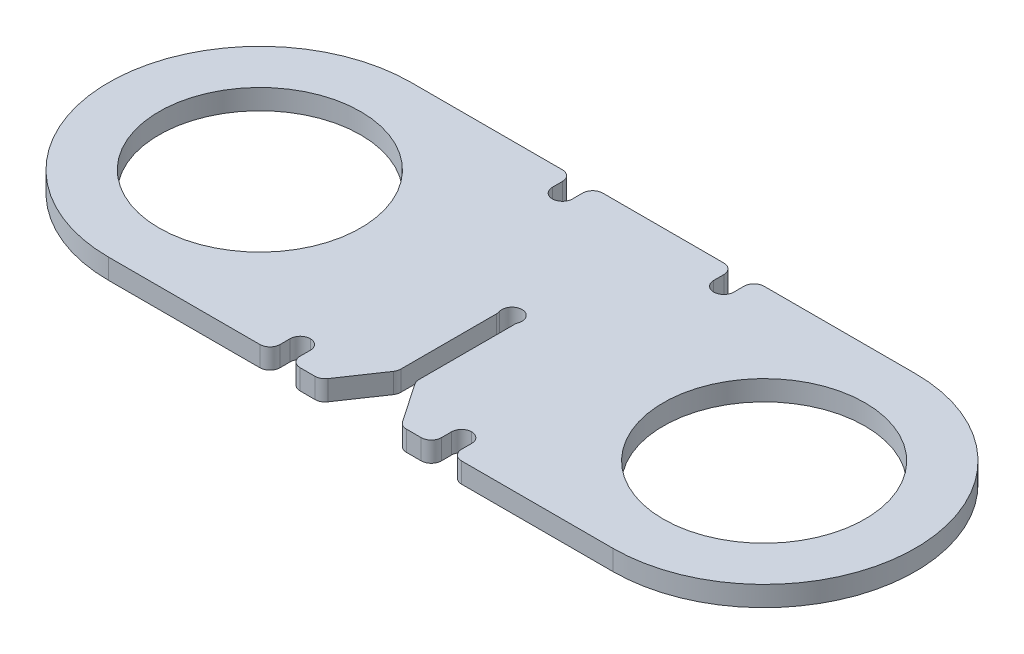
from build123d import *

# Parameters (mm, degrees)
SKETCH1_R           = 10
SKETCH1_R_2         = 1
BOSS_EXTRUDE1_DEPTH = 2
SKETCH2_W           = 2
SKETCH2_H           = 3
CUT_EXTRUDE1_DEPTH  = 72.617037079
FILLET1_START       = -1
FILLET1_DEPTH       = 4
FILLET1_2_DEPTH     = 2
CUT_EXTRUDE2_DEPTH  = 72.617037079
FILLET2_R           = 1


with BuildPart() as part:
    # Sketch1 → Boss-Extrude1 (new body)
    with BuildSketch(Plane(origin=(0, 0, 0), x_dir=(1, 0, 0), z_dir=(0, 1, 0))):
        with BuildLine():
            Line((0, 0), (50, 0))
            ThreePointArc((50, 0), (65, 15), (50, 30))
            Line((50, 30), (0, 30))
            ThreePointArc((0, 30), (-15, 15), (0, 0))
        make_face()
        with Locations(Location((0, 15, 0), (0, 0, 270))):
            Circle(SKETCH1_R, mode=Mode.SUBTRACT)
        with Locations(Location((50, 15, 0), (0, 0, 270))):
            Circle(SKETCH1_R, mode=Mode.SUBTRACT)
        with Locations(Location((25, 15, 0), (0, 0, 270))):
            Circle(SKETCH1_R_2, mode=Mode.SUBTRACT)
    extrude(amount=BOSS_EXTRUDE1_DEPTH)

    # Sketch2 → Cut-Extrude1 (cut, through all)
    with BuildSketch(Plane(origin=(0, 2, 0), x_dir=(1, 0, 0), z_dir=(0, 1, 0))):
        with Locations((17, 28.5)):
            Rectangle(SKETCH2_W, SKETCH2_H)
        with Locations((33, 28.5)):
            Rectangle(SKETCH2_W, SKETCH2_H)
        with Locations((17, 1.5)):
            Rectangle(SKETCH2_W, SKETCH2_H)
        with Locations((33, 1.5)):
            Rectangle(SKETCH2_W, SKETCH2_H)
    extrude(amount=-CUT_EXTRUDE1_DEPTH, mode=Mode.SUBTRACT)

    # Fillet1: read off the stored shape, not the designer's step
    # Fillet1 outline → Fillet1 (cut)
    with BuildSketch(Plane(origin=(0, 0, 0), x_dir=(1, 0, 0), z_dir=(0, 1, 0)).offset(FILLET1_START)):
        with BuildLine():
            ThreePointArc((35, 0), (34.292893219, 0.292893219), (34, 1))
            Line((34, 1), (34, 0))
            Line((34, 0), (35, 0))
        make_face()
        with BuildLine():
            ThreePointArc((32, 1), (31.707106781, 0.292893219), (31, 0))
            Line((31, 0), (32, 0))
            Line((32, 0), (32, 1))
        make_face()
        with BuildLine():
            ThreePointArc((19, 0), (18.292893219, 0.292893219), (18, 1))
            Line((18, 1), (18, 0))
            Line((18, 0), (19, 0))
        make_face()
        with BuildLine():
            ThreePointArc((16, 1), (15.707106781, 0.292893219), (15, 0))
            Line((15, 0), (16, 0))
            Line((16, 0), (16, 1))
        make_face()
        with BuildLine():
            ThreePointArc((15, 30), (15.707106781, 29.707106781), (16, 29))
            Line((16, 29), (16, 30))
            Line((16, 30), (15, 30))
        make_face()
        with BuildLine():
            ThreePointArc((18, 29), (18.292893219, 29.707106781), (19, 30))
            Line((19, 30), (18, 30))
            Line((18, 30), (18, 29))
        make_face()
        with BuildLine():
            ThreePointArc((31, 30), (31.707106781, 29.707106781), (32, 29))
            Line((32, 29), (32, 30))
            Line((32, 30), (31, 30))
        make_face()
        with BuildLine():
            ThreePointArc((34, 29), (34.292893219, 29.707106781), (35, 30))
            Line((35, 30), (34, 30))
            Line((34, 30), (34, 29))
        make_face()
    extrude(amount=FILLET1_DEPTH, mode=Mode.SUBTRACT)

    # Fillet1 2 outline → Fillet1 2 (add)
    with BuildSketch(Plane(origin=(0, 0, 0), x_dir=(1, 0, 0), z_dir=(0, 1, 0))):
        with BuildLine():
            Line((34, 3), (33, 3))
            ThreePointArc((33, 3), (33.707106781, 2.707106781), (34, 2))
            Line((34, 2), (34, 3))
        make_face()
        with BuildLine():
            Line((32, 3), (32, 2))
            ThreePointArc((32, 2), (32.292893219, 2.707106781), (33, 3))
            Line((33, 3), (32, 3))
        make_face()
        with BuildLine():
            Line((18, 3), (17, 3))
            ThreePointArc((17, 3), (17.707106781, 2.707106781), (18, 2))
            Line((18, 2), (18, 3))
        make_face()
        with BuildLine():
            Line((16, 3), (16, 2))
            ThreePointArc((16, 2), (16.292893219, 2.707106781), (17, 3))
            Line((17, 3), (16, 3))
        make_face()
        with BuildLine():
            Line((16, 27), (17, 27))
            ThreePointArc((17, 27), (16.292893219, 27.292893219), (16, 28))
            Line((16, 28), (16, 27))
        make_face()
        with BuildLine():
            Line((18, 27), (18, 28))
            ThreePointArc((18, 28), (17.707106781, 27.292893219), (17, 27))
            Line((17, 27), (18, 27))
        make_face()
        with BuildLine():
            Line((32, 27), (33, 27))
            ThreePointArc((33, 27), (32.292893219, 27.292893219), (32, 28))
            Line((32, 28), (32, 27))
        make_face()
        with BuildLine():
            Line((34, 27), (34, 28))
            ThreePointArc((34, 28), (33.707106781, 27.292893219), (33, 27))
            Line((33, 27), (34, 27))
        make_face()
    extrude(amount=FILLET1_2_DEPTH)

    # Sketch3 → Cut-Extrude2 (cut, through all)
    with BuildSketch(Plane(origin=(0, 2, 0), x_dir=(1, 0, 0), z_dir=(0, 1, 0))):
        Polygon((24.1, 14.564110106), (25.9, 14.564110106), (25.9, 4.564110106), (29, 0), (21, 0), (24.1, 4.564110106), align=None)
    extrude(amount=-CUT_EXTRUDE2_DEPTH, mode=Mode.SUBTRACT)

    # Fillet2
    fillet2_edges = [part.edges().sort_by_distance(p)[0] for p in [
        (24.1, 1, -4.564110106),
        (24.1, 1, -14.564110106),
        (25.9, 1, -14.564110106),
        (25.9, 1, -4.564110106),
        (29, 1, 0),
        (21, 1, 0),
    ]]
    fillet(fillet2_edges, radius=FILLET2_R)


solid = part.part
